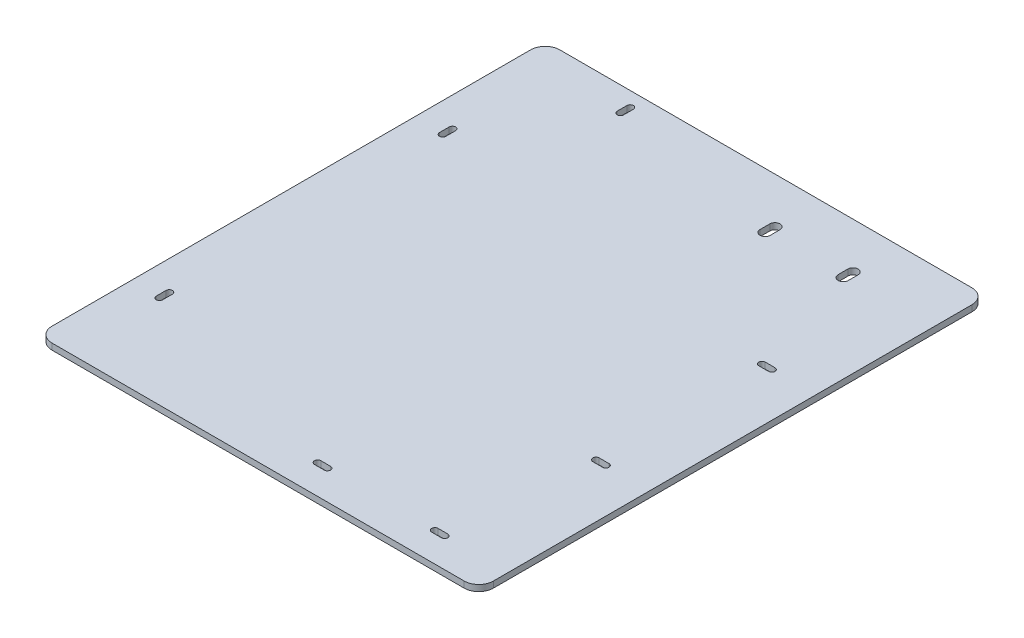
from build123d import *

# Parameters (mm, degrees)
SKETCH1_W           = 226
SKETCH1_H           = 260
BOSS_EXTRUDE1_DEPTH = 3.175
FILLET1_R           = 7.5


with BuildPart() as part:
    # Sketch1 → Boss-Extrude1 (new body)
    with BuildSketch(Plane(origin=(0, 0, 0), x_dir=(1, 0, 0), z_dir=(0, 1, 0))):
        Rectangle(SKETCH1_W, SKETCH1_H)
        with BuildLine():
            Line((30.6, 106.6), (30.6, 101.6))
            ThreePointArc((30.6, 101.6), (28, 99), (25.4, 101.6))
            Line((25.4, 101.6), (25.4, 106.6))
            ThreePointArc((25.4, 106.6), (28, 109.2), (30.6, 106.6))
        make_face(mode=Mode.SUBTRACT)
        with BuildLine():
            Line((70.6, 106.6), (70.6, 101.6))
            ThreePointArc((70.6, 101.6), (68, 99), (65.4, 101.6))
            Line((65.4, 101.6), (65.4, 106.6))
            ThreePointArc((65.4, 106.6), (68, 109.2), (70.6, 106.6))
        make_face(mode=Mode.SUBTRACT)
        with BuildLine():
            Line((-96.35, 67.5), (-96.35, 62.5))
            ThreePointArc((-96.35, 62.5), (-98, 60.85), (-99.65, 62.5))
            Line((-99.65, 62.5), (-99.65, 67.5))
            ThreePointArc((-99.65, 67.5), (-98, 69.15), (-96.35, 67.5))
        make_face(mode=Mode.SUBTRACT)
        with BuildLine():
            Line((85.5, 44.15), (90.5, 44.15))
            ThreePointArc((90.5, 44.15), (92.15, 42.5), (90.5, 40.85))
            Line((90.5, 40.85), (85.5, 40.85))
            ThreePointArc((85.5, 40.85), (83.85, 42.5), (85.5, 44.15))
        make_face(mode=Mode.SUBTRACT)
        with BuildLine():
            Line((85.5, -40.85), (90.5, -40.85))
            ThreePointArc((90.5, -40.85), (92.15, -42.5), (90.5, -44.15))
            Line((90.5, -44.15), (85.5, -44.15))
            ThreePointArc((85.5, -44.15), (83.85, -42.5), (85.5, -40.85))
        make_face(mode=Mode.SUBTRACT)
        with BuildLine():
            Line((15.5, -113.35), (20.5, -113.35))
            ThreePointArc((20.5, -113.35), (22.15, -115), (20.5, -116.65))
            Line((20.5, -116.65), (15.5, -116.65))
            ThreePointArc((15.5, -116.65), (13.85, -115), (15.5, -113.35))
        make_face(mode=Mode.SUBTRACT)
        with BuildLine():
            Line((80.5, -116.65), (75.5, -116.65))
            ThreePointArc((75.5, -116.65), (73.85, -115), (75.5, -113.35))
            Line((75.5, -113.35), (80.5, -113.35))
            ThreePointArc((80.5, -113.35), (82.15, -115), (80.5, -116.65))
        make_face(mode=Mode.SUBTRACT)
        with BuildLine():
            Line((-96.35, -77.5), (-96.35, -82.5))
            ThreePointArc((-96.35, -82.5), (-98, -84.15), (-99.65, -82.5))
            Line((-99.65, -82.5), (-99.65, -77.5))
            ThreePointArc((-99.65, -77.5), (-98, -75.85), (-96.35, -77.5))
        make_face(mode=Mode.SUBTRACT)
        with BuildLine():
            Line((-63.65, 117.5), (-63.65, 122.5))
            ThreePointArc((-63.65, 122.5), (-62, 124.15), (-60.35, 122.5))
            Line((-60.35, 122.5), (-60.35, 117.5))
            ThreePointArc((-60.35, 117.5), (-62, 115.85), (-63.65, 117.5))
        make_face(mode=Mode.SUBTRACT)
    extrude(amount=BOSS_EXTRUDE1_DEPTH)

    # Fillet1
    fillet1_edges = [part.edges().sort_by_distance(p)[0] for p in [
        (113, 1.5875, -130),
        (113, 1.5875, 130),
        (-113, 1.5875, 130),
        (-113, 1.5875, -130),
    ]]
    fillet(fillet1_edges, radius=FILLET1_R)


solid = part.part
